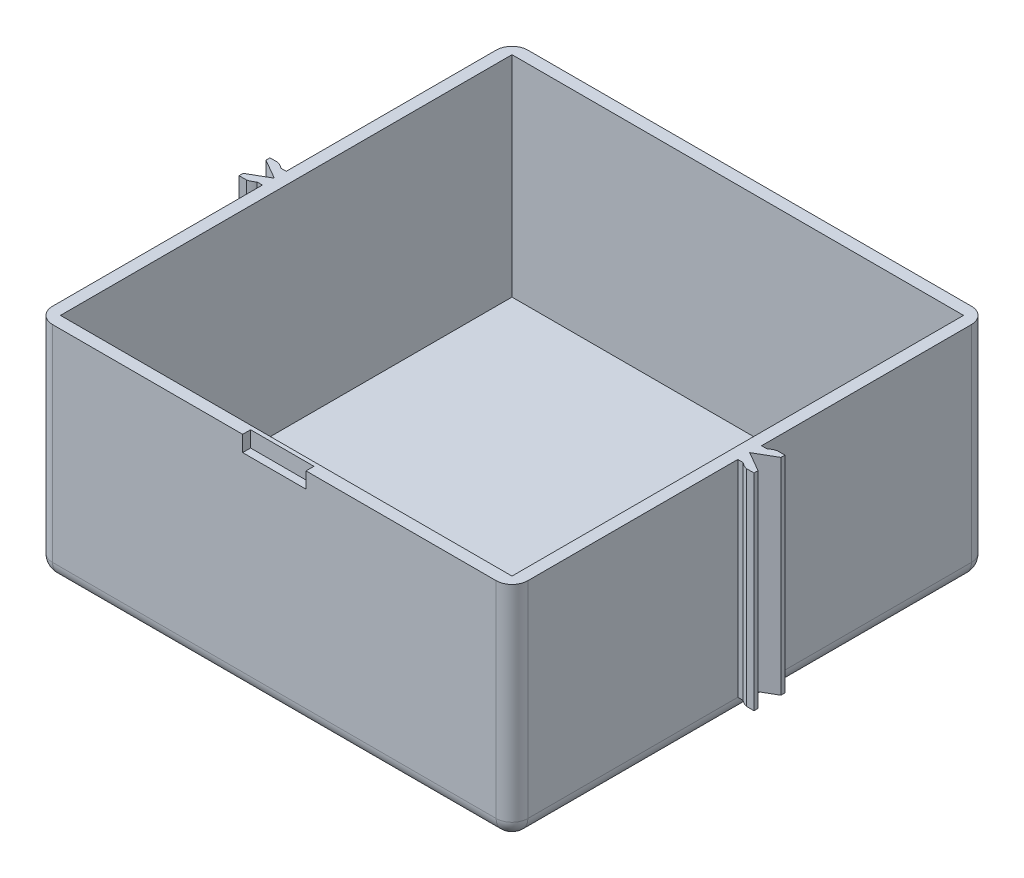
from build123d import *

# Parameters (mm, degrees)
SKETCH_1_W            = 60
SKETCH_1_H            = 60
EXTRUDE_1_DEPTH       = 28
SKETCH_2_W            = 57
SKETCH_2_H            = 57
CUT_EXTRUDE_1_DEPTH   = 26.5
EXTRUDE_3_DEPTH       = 26
MIRROR_5_COPY_1_DEPTH = 26
SKETCH_4_W            = 8
SKETCH_4_H            = 2
CUT_EXTRUDE_2_DEPTH   = 2
FILLET_1_R            = 2


with BuildPart() as part:
    # 草图1 → 凸台-拉伸1 (new body)
    with BuildSketch(Plane(origin=(0, 0, 0), x_dir=(1, 0, 0), z_dir=(0, 1, 0))):
        Rectangle(SKETCH_1_W, SKETCH_1_H)
    extrude(amount=EXTRUDE_1_DEPTH)

    # 草图2 → 切除-拉伸1 (cut)
    with BuildSketch(Plane(origin=(0, 28, 0), x_dir=(1, 0, 0), z_dir=(0, 1, 0))):
        Rectangle(SKETCH_2_W, SKETCH_2_H)
    extrude(amount=-CUT_EXTRUDE_1_DEPTH, mode=Mode.SUBTRACT)

    # 草图3 → 凸台-拉伸3 (add)
    with BuildSketch(Plane(origin=(0, 28, 0), x_dir=(1, 0, 0), z_dir=(0, 1, 0))):
        with BuildLine():
            Line((-30, 0), (-30, -1.5))
            Line((-30, -1.5), (-30.677124344, -1.5))
            ThreePointArc((-30.677124344, -1.5), (-31.088161527, -1.780042303), (-31.555590279, -1.95))
            Line((-31.555590279, -1.95), (-32.5, -1.95))
            Line((-32.5, -1.95), (-32.5, -1.443375673))
            Line((-32.5, -1.443375673), (-30, 0))
        make_face()
    extrude_3 = extrude(amount=-EXTRUDE_3_DEPTH)

    # 镜向4: 凸台-拉伸3 across plane
    add(extrude_3.mirror(Plane.XY))

    # 镜向5: 凸台-拉伸3 across plane
    add(extrude_3.mirror(Plane(origin=(0, 0, 0), x_dir=(0, 0, 1), z_dir=(1, 0, 0))))

    # 镜向5 copy 1 sketch → 镜向5 copy 1 (add)
    with BuildSketch(Plane(origin=(0, 28, 0), x_dir=(-1, 0, 0), z_dir=(0, 1, 0))):
        with BuildLine():
            Line((-30, 0), (-30, -1.5))
            Line((-30, -1.5), (-30.677124344, -1.5))
            ThreePointArc((-30.677124344, -1.5), (-31.088161527, -1.780042303), (-31.555590279, -1.95))
            Line((-31.555590279, -1.95), (-32.5, -1.95))
            Line((-32.5, -1.95), (-32.5, -1.443375673))
            Line((-32.5, -1.443375673), (-30, 0))
        make_face()
    extrude(amount=-MIRROR_5_COPY_1_DEPTH)

    # 草图4 → 切除-拉伸2 (cut)
    with BuildSketch(Plane(origin=(0, 28, 0), x_dir=(1, 0, 0), z_dir=(0, 1, 0))):
        with Locations((0, -30)):
            Rectangle(SKETCH_4_W, SKETCH_4_H)
    extrude(amount=-CUT_EXTRUDE_2_DEPTH, mode=Mode.SUBTRACT)

    # 圆角1
    fillet_1_edges = [part.edges().sort_by_distance(p)[0] for p in [
        (-30, 0, 0),
        (0, 0, 30),
        (30, 0, 0),
        (0, 0, -30),
        (30, 14, 30),
        (-30, 14, 30),
        (30, 14, -30),
        (-30, 14, -30),
    ]]
    fillet(fillet_1_edges, radius=FILLET_1_R - 0.0001)  # a hair under: the kernel refuses the full size


solid = part.part
